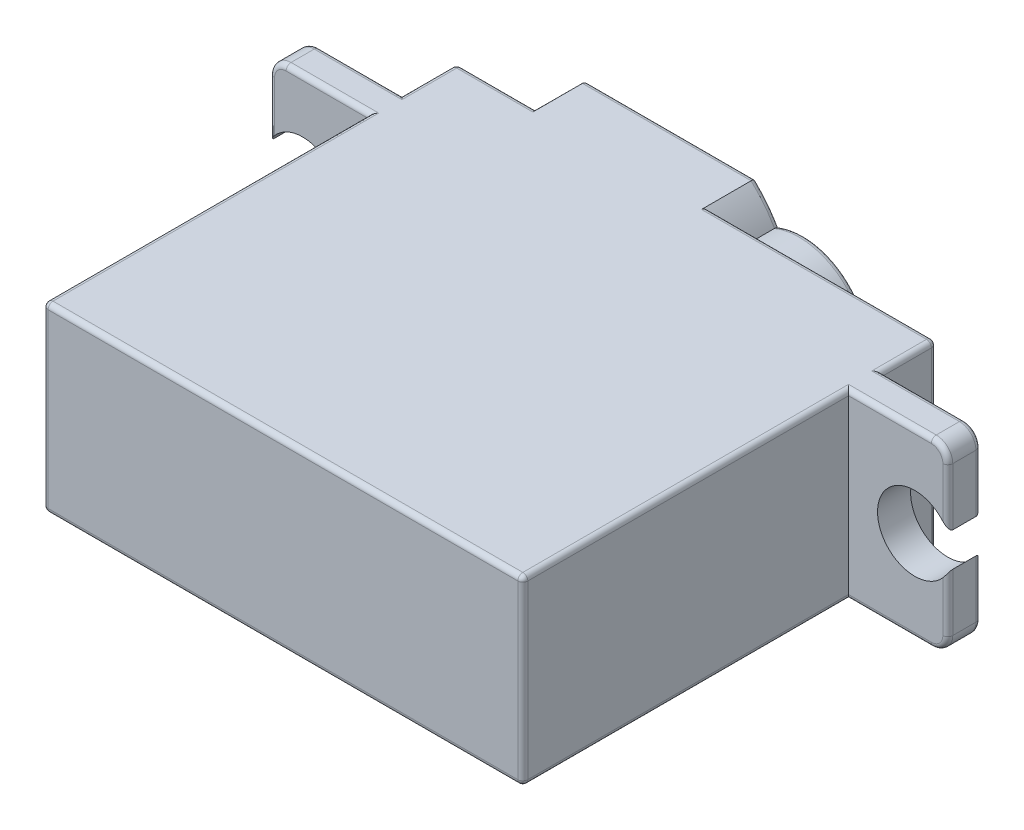
from build123d import *

# Parameters (mm, degrees)
BOSS_EXTRUDE1_DEPTH = 11
BOSS_EXTRUDE2_DEPTH = 3
SKETCH3_R           = 2
BOSS_EXTRUDE3_DEPTH = 3
FILLET2_R           = 0.3
FILLET3_R           = 1
SKETCH4_R           = 2.25
CUT_EXTRUDE1_DEPTH  = 32.80769114


with BuildPart() as part:
    # Sketch1 → Boss-Extrude1 (new body)
    with BuildSketch(Plane(origin=(0, 0, 0), x_dir=(1, 0, 0), z_dir=(0, 1, 0))):
        Polygon((-14.5, 9.190532713), (-14.5, 12.5), (14.5, 12.5), (14.5, 9.190532713), (20.5, 9.190532713), (20.5, 7.190532713), (14.5, 7.190532713), (14.5, -12.5), (-14.5, -12.5), (-14.5, 7.190532713), (-20.5, 7.190532713), (-20.5, 9.190532713), align=None)
    extrude(amount=BOSS_EXTRUDE1_DEPTH)

    # Sketch2 → Boss-Extrude2 (add)
    with BuildSketch(Plane(origin=(0, 0, -12.5), x_dir=(-1, 0, 0), z_dir=(0, 0, -1))):
        with BuildLine():
            Line((-0.599019514, 11), (9.599019514, 11))
            ThreePointArc((9.599019514, 11), (12, 5.5), (9.599019514, 0))
            Line((9.599019514, 0), (-0.599019514, 0))
            ThreePointArc((-0.599019514, 0), (-1.375551041, 0.838680449), (-2.015625, 1.785618375))
            ThreePointArc((-2.015625, 1.785618375), (-7.5, 5.5), (-2.015625, 9.214381625))
            ThreePointArc((-2.015625, 9.214381625), (-1.375551041, 10.161319551), (-0.599019514, 11))
        make_face()
    extrude(amount=BOSS_EXTRUDE2_DEPTH)

    # Sketch3 → Boss-Extrude3 (add)
    with BuildSketch(Plane(origin=(0, 0, -15.5), x_dir=(-1, 0, 0), z_dir=(0, 0, -1))):
        with Locations((4.5, 5.5)):
            Circle(SKETCH3_R)
    extrude(amount=BOSS_EXTRUDE3_DEPTH)

    # Fillet2
    fillet2_edges = [part.edges().sort_by_distance(p)[0] for p in [
        (-14.5, 5.5, -12.5),
        (14.5, 5.5, -12.5),
        (-20.5, 5.5, -9.190532713),
        (-4.5, 11, -15.5),
        (-12.049509757, 11, -12.5),
        (-14.5, 11, -10.845266356),
        (-17.5, 11, -9.190532713),
        (-14.5, 11, 2.654733644),
        (14.5, 11, 2.654733644),
        (20.5, 5.5, -9.190532713),
        (17.5, 11, -9.190532713),
        (14.5, 11, -10.845266356),
        (1.375551041, 10.161319551, -15.5),
        (7.549509757, 11, -12.5),
        (20.5, 5.5, -7.190532713),
        (-20.5, 5.5, -7.190532713),
        (-17.5, 11, -7.190532713),
        (17.5, 11, -7.190532713),
        (14.5, 5.5, 12.5),
        (0, 11, 12.5),
        (-14.5, 5.5, 12.5),
        (-14.5, 0, 2.654733644),
        (-17.5, 0, -7.190532713),
        (-14.5, 0, -10.845266356),
        (-17.5, 0, -9.190532713),
        (-2.5, 5.5, -18.5),
        (-12, 5.5, -15.5),
        (7.5, 5.5, -15.5),
        (1.375551041, 0.838680449, -15.5),
        (-4.5, 0, -15.5),
        (-12.049509757, 0, -12.5),
        (7.549509757, 0, -12.5),
        (14.5, 0, -10.845266356),
        (17.5, 0, -9.190532713),
        (17.5, 0, -7.190532713),
        (14.5, 0, 2.654733644),
        (0, 0, 12.5),
    ]]
    fillet(fillet2_edges, radius=FILLET2_R)

    # Fillet3
    # the kernel refuses this fillet: 1 mm, written as the material it takes off along each edge
    with BuildSketch(Plane(origin=(-19.5, 10, -9.190532713), x_dir=(-1, 0, 0), z_dir=(0, -1, 0))) as fillet3_piece_1:
        with BuildLine():
            CenterArc((0.7, -0.3), 0.3, 0, 90)
            Line((1, -0.3), (1, 0))
            Line((1, 0), (0.7, 0))
        make_face()
    revolve(axis=Axis((-19.5, 10, -9.190532713), (0, 0, -1)), revolution_arc=90, mode=Mode.SUBTRACT)
    with BuildSketch(Plane(origin=(-19.5, 1, -9.190532713), x_dir=(0, -1, 0), z_dir=(1, 0, 0))) as fillet3_piece_2:
        with BuildLine():
            CenterArc((0.7, -0.3), 0.3, 0, 90)
            Line((1, -0.3), (1, 0))
            Line((1, 0), (0.7, 0))
        make_face()
    revolve(axis=Axis((-19.5, 1, -9.190532713), (0, 0, -1)), revolution_arc=90, mode=Mode.SUBTRACT)
    with BuildSketch(Plane(origin=(19.5, 10, -9.190532713), x_dir=(0, 1, 0), z_dir=(-1, 0, 0))) as fillet3_piece_3:
        with BuildLine():
            CenterArc((0.7, -0.3), 0.3, 0, 90)
            Line((1, -0.3), (1, 0))
            Line((1, 0), (0.7, 0))
        make_face()
    revolve(axis=Axis((19.5, 10, -9.190532713), (0, 0, -1)), revolution_arc=90, mode=Mode.SUBTRACT)
    with BuildSketch(Plane(origin=(19.5, 1, -9.190532713), x_dir=(1, 0, 0), z_dir=(0, 1, 0))) as fillet3_piece_4:
        with BuildLine():
            CenterArc((0.7, -0.3), 0.3, 0, 90)
            Line((1, -0.3), (1, 0))
            Line((1, 0), (0.7, 0))
        make_face()
    revolve(axis=Axis((19.5, 1, -9.190532713), (0, 0, -1)), revolution_arc=90, mode=Mode.SUBTRACT)
    with BuildSketch(Plane(origin=(19.5, 1, -7.190532713), x_dir=(0, -1, 0), z_dir=(-1, 0, 0))) as fillet3_piece_5:
        with BuildLine():
            CenterArc((0.7, -0.3), 0.3, 0, 90)
            Line((1, -0.3), (1, 0))
            Line((1, 0), (0.7, 0))
        make_face()
    revolve(axis=Axis((19.5, 1, -7.190532713), (0, 0, 1)), revolution_arc=90, mode=Mode.SUBTRACT)
    with BuildSketch(Plane(origin=(19.5, 10, -7.190532713), x_dir=(1, 0, 0), z_dir=(0, -1, 0))) as fillet3_piece_6:
        with BuildLine():
            CenterArc((0.7, -0.3), 0.3, 0, 90)
            Line((1, -0.3), (1, 0))
            Line((1, 0), (0.7, 0))
        make_face()
    revolve(axis=Axis((19.5, 10, -7.190532713), (0, 0, 1)), revolution_arc=90, mode=Mode.SUBTRACT)
    with BuildSketch(Plane(origin=(-19.5, 1, -7.190532713), x_dir=(-1, 0, 0), z_dir=(0, 1, 0))) as fillet3_piece_7:
        with BuildLine():
            CenterArc((0.7, -0.3), 0.3, 0, 90)
            Line((1, -0.3), (1, 0))
            Line((1, 0), (0.7, 0))
        make_face()
    revolve(axis=Axis((-19.5, 1, -7.190532713), (0, 0, 1)), revolution_arc=90, mode=Mode.SUBTRACT)
    with BuildSketch(Plane(origin=(-19.5, 10, -7.190532713), x_dir=(0, 1, 0), z_dir=(1, 0, 0))) as fillet3_piece_8:
        with BuildLine():
            CenterArc((0.7, -0.3), 0.3, 0, 90)
            Line((1, -0.3), (1, 0))
            Line((1, 0), (0.7, 0))
        make_face()
    revolve(axis=Axis((-19.5, 10, -7.190532713), (0, 0, 1)), revolution_arc=90, mode=Mode.SUBTRACT)
    with BuildSketch(Plane(origin=(-20.5, 0, -7.190532713), x_dir=(1, 0, 0), z_dir=(0, 0, -1)), Plane(origin=(20.5, 0, -9.190532713), x_dir=(-1, 0, 0), z_dir=(0, 0, 1))) as fillet3_piece_9:
        with BuildLine():
            CenterArc((FILLET3_R, -FILLET3_R), FILLET3_R, 90, 90)
            Line((0, -FILLET3_R), (0, 0))
            Line((0, 0), (FILLET3_R, 0))
        make_face()
    extrude(amount=2, mode=Mode.SUBTRACT)
    with BuildSketch(Plane(origin=(-20.5, 11, -7.190532713), x_dir=(1, 0, 0), z_dir=(0, 0, -1)), Plane(origin=(20.5, 11, -9.190532713), x_dir=(-1, 0, 0), z_dir=(0, 0, 1))) as fillet3_piece_10:
        with BuildLine():
            CenterArc((FILLET3_R, FILLET3_R), FILLET3_R, 180, 90)
            Line((0, FILLET3_R), (0, 0))
            Line((0, 0), (FILLET3_R, 0))
        make_face()
    extrude(amount=2, mode=Mode.SUBTRACT)

    # Sketch4 → Cut-Extrude1 (cut, through all)
    with BuildSketch(Plane(origin=(0, 0, -9.190532713), x_dir=(-1, 0, 0), z_dir=(0, 0, -1))):
        with Locations((-18.5, 5.5)):
            Circle(SKETCH4_R)
    cut_extrude1 = extrude(amount=-CUT_EXTRUDE1_DEPTH, mode=Mode.SUBTRACT)

    # Mirror1: Cut-Extrude1 across plane
    add(cut_extrude1.mirror(Plane(origin=(0, 0, 0), x_dir=(0, 0, 1), z_dir=(1, 0, 0))), mode=Mode.SUBTRACT)


solid = part.part
